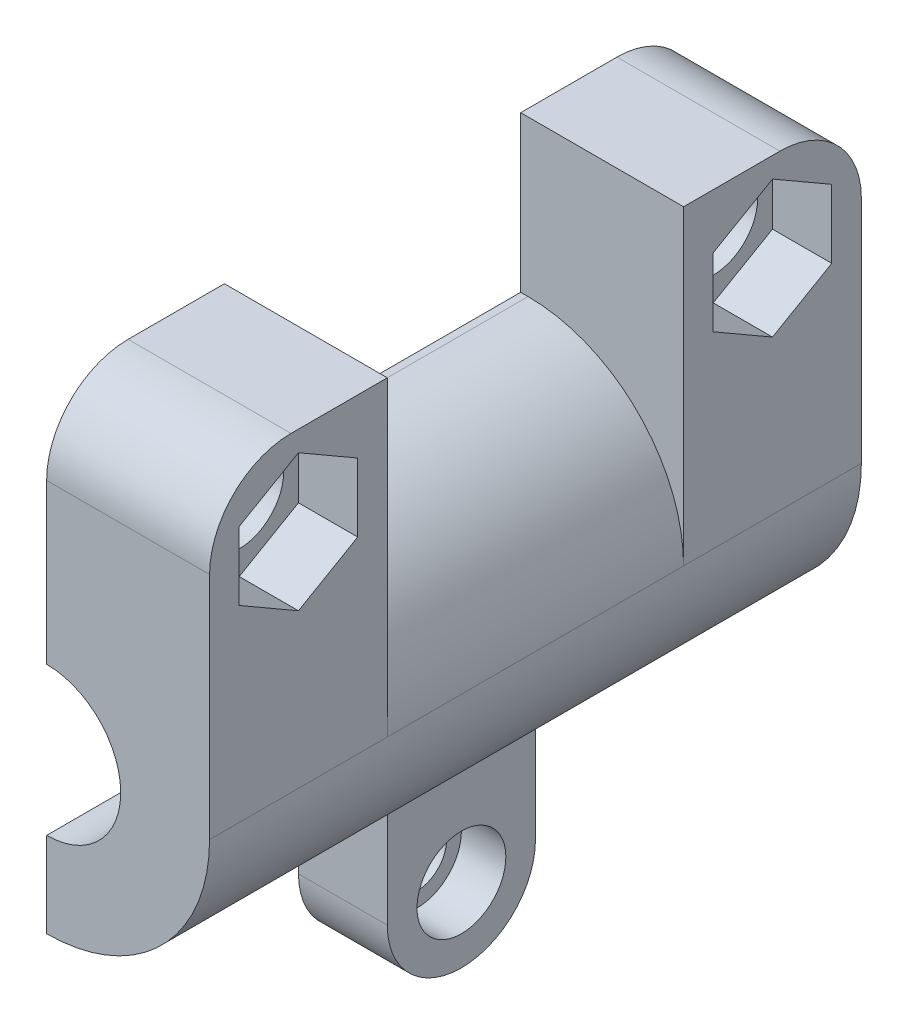
from build123d import *

# Parameters (mm, degrees)
SKETCH1_W               = 44
SKETCH1_H               = 32
BOSS_EXTRUDE1_DEPTH     = 11
SKETCH2_W               = 24.5
SKETCH2_H               = 15.5
CUT_EXTRUDE1_DEPTH      = 7.75
FILLET1_R               = 7.75
CUT_EXTRUDE2_DEPTH      = 40.370833113
CUT_EXTRUDE2_DEPTH_BACK = 40.370833113
SKETCH4_R               = 3
SKETCH4_W               = 20
SKETCH4_H               = 10.5
CUT_EXTRUDE3_DEPTH      = 30.342801502
FILLET4_R               = 5.5
SKETCH7_W               = 10
SKETCH7_H               = 10
SKETCH7_R               = 2
BOSS_EXTRUDE5_DEPTH     = 6
FILLET5_R               = 5
CUT_EXTRUDE7_START      = -3
SKETCH9_R               = 3
SKETCH9_R_2             = 2
CUT_EXTRUDE7_DEPTH      = 3
SKETCH10_R              = 3
CUT_EXTRUDE8_DEPTH      = 4
FILLET7_R               = 10.5
FILLET8_R               = 11


# Some blends are built 0.0001 mm under size
with BuildPart() as part:
    # Sketch1 → Boss-Extrude1 (new body)
    with BuildSketch(Plane(origin=(0, 0, 0), x_dir=(0, 0, -1), z_dir=(1, 0, 0))):
        Rectangle(SKETCH1_W, SKETCH1_H)
    extrude(amount=BOSS_EXTRUDE1_DEPTH)

    # Sketch2 → Cut-Extrude1 (cut)
    with BuildSketch(Plane(origin=(0, 0, 0), x_dir=(0, 0, -1), z_dir=(1, 0, 0))):
        with Locations((0, -5.25)):
            Rectangle(SKETCH2_W, SKETCH2_H)
    extrude(amount=CUT_EXTRUDE1_DEPTH, mode=Mode.SUBTRACT)

    # Fillet1
    fillet1_edges = [part.edges().sort_by_distance(p)[0] for p in [
        (7.75, 2.5, 0),
        (7.75, -13, 0),
    ]]
    fillet(fillet1_edges, radius=FILLET1_R - 0.0001)  # a hair under: the kernel refuses the full size

    # Sketch3 → Cut-Extrude2 (cut, two sides: drawn at the far end of the back side and taken through both)
    with BuildSketch(Plane.XY.offset(-12.25).offset(-CUT_EXTRUDE2_DEPTH_BACK)):
        with BuildLine():
            ThreePointArc((0, -10.25), (3.535533906, -8.785533906), (5, -5.25))
            ThreePointArc((5, -5.25), (3.535533906, -1.714466094), (0, -0.25))
            Line((0, -0.25), (0, -10.25))
        make_face()
        with BuildLine():
            Line((0, -10.25), (0, -0.25))
            ThreePointArc((0, -0.25), (-5, -5.25), (0, -10.25))
        make_face()
    extrude(amount=CUT_EXTRUDE2_DEPTH + CUT_EXTRUDE2_DEPTH_BACK, mode=Mode.SUBTRACT)

    # Sketch4 → Cut-Extrude3 (cut, through all)
    with BuildSketch(Plane(origin=(11, 0, 0), x_dir=(0, 0, -1), z_dir=(1, 0, 0))):
        with Locations((-16, 10)):
            Circle(SKETCH4_R)
        with Locations((16, 10)):
            Circle(SKETCH4_R)
        with Locations((0, 10.75)):
            Rectangle(SKETCH4_W, SKETCH4_H)
    extrude(amount=-CUT_EXTRUDE3_DEPTH, mode=Mode.SUBTRACT)

    # Fillet4
    fillet4_edges = [part.edges().sort_by_distance(p)[0] for p in [
        (5.5, 16, 22),
        (5.5, 16, -22),
    ]]
    fillet(fillet4_edges, radius=FILLET4_R)

    # Sketch7 → Boss-Extrude5 (add)
    with BuildSketch(Plane(origin=(0, 0, 0), x_dir=(0, 0, -1), z_dir=(1, 0, 0))):
        with Locations((0, -21)):
            Rectangle(SKETCH7_W, SKETCH7_H)
        with Locations((0, -21)):
            Circle(SKETCH7_R, mode=Mode.SUBTRACT)
    extrude(amount=BOSS_EXTRUDE5_DEPTH)

    # Fillet5
    fillet5_edges = [part.edges().sort_by_distance(p)[0] for p in [
        (3, -26, -5),
        (3, -26, 5),
    ]]
    fillet(fillet5_edges, radius=FILLET5_R - 0.0001)  # a hair under: the kernel refuses the full size

    # Sketch9 → Cut-Extrude7 (cut)
    with BuildSketch(Plane(origin=(6, 0, 0), x_dir=(0, 0, -1), z_dir=(1, 0, 0)).offset(CUT_EXTRUDE7_START)):
        with Locations((0, -21)):
            Circle(SKETCH9_R)
        with Locations((0, -21)):
            Circle(SKETCH9_R_2, mode=Mode.SUBTRACT)
    extrude(amount=CUT_EXTRUDE7_DEPTH, mode=Mode.SUBTRACT)

    # Sketch10 → Cut-Extrude8 (cut)
    # profile 1 of 2: a face of its own
    with BuildSketch(Plane(origin=(11, 0, 0), x_dir=(0, 0, -1), z_dir=(1, 0, 0))):
        Polygon((-16, 5.381197846), (-12, 7.690598923), (-12, 12.309401077), (-16, 14.618802154), (-20, 12.309401077), (-20, 7.690598923), align=None)
        with Locations((-16, 10)):
            Circle(SKETCH10_R, mode=Mode.SUBTRACT)
    # profile 2 of 2: a face of its own
    with BuildSketch(Plane(origin=(11, 0, 0), x_dir=(0, 0, -1), z_dir=(1, 0, 0))):
        Polygon((16, 5.381197846), (20, 7.690598923), (20, 12.309401077), (16, 14.618802154), (12, 12.309401077), (12, 7.690598923), align=None)
        with Locations((16, 10)):
            Circle(SKETCH10_R, mode=Mode.SUBTRACT)
    extrude(amount=-CUT_EXTRUDE8_DEPTH, mode=Mode.SUBTRACT)

    # Fillet7
    fillet7_edges = [part.edges().sort_by_distance(p)[0] for p in [
        (11, 5.5, 0),
    ]]
    fillet(fillet7_edges, radius=FILLET7_R)

    # Fillet8
    # the kernel refuses this fillet: 11 mm, written as the material it takes off along each edge
    with BuildSketch(Plane(origin=(11, -16, 49.5), x_dir=(0, 1, 0), z_dir=(0, 0, -1))) as fillet8_piece_1_section:
        with BuildLine():
            CenterArc((FILLET8_R, -FILLET8_R), FILLET8_R, 90, 90)
            Line((0, -FILLET8_R), (0, 0))
            Line((0, 0), (FILLET8_R, 0))
        make_face()
    fillet8_piece_1 = extrude(amount=99, mode=Mode.PRIVATE)
    fillet8_piece_1 = split(fillet8_piece_1, bisect_by=Plane(origin=(6, -13.119412113, 27.25), z_dir=(1, 0, 0)), keep=Keep.TOP, mode=Mode.PRIVATE)
    fillet8_piece_1 = split(fillet8_piece_1, bisect_by=Plane(origin=(9.313036117, -13.119412113, 5), z_dir=(0, 0, 1)), keep=Keep.TOP, mode=Mode.PRIVATE)
    add(fillet8_piece_1, mode=Mode.SUBTRACT)
    with BuildSketch(Plane(origin=(11, -16, 49.5), x_dir=(0, 1, 0), z_dir=(0, 0, -1))) as fillet8_piece_2_section:
        with BuildLine():
            CenterArc((FILLET8_R, -FILLET8_R), FILLET8_R, 90, 90)
            Line((0, -FILLET8_R), (0, 0))
            Line((0, 0), (FILLET8_R, 0))
        make_face()
    fillet8_piece_2 = extrude(amount=99, mode=Mode.PRIVATE)
    fillet8_piece_2 = split(fillet8_piece_2, bisect_by=Plane(origin=(6, -15.650616863, 27.25), z_dir=(-1, 0, 0)), keep=Keep.TOP, mode=Mode.PRIVATE)
    fillet8_piece_2 = split(fillet8_piece_2, bisect_by=Plane(origin=(4.102097244, -15.650616863, 5), z_dir=(0, 0, 1)), keep=Keep.TOP, mode=Mode.PRIVATE)
    add(fillet8_piece_2, mode=Mode.SUBTRACT)
    with BuildSketch(Plane(origin=(11, -16, 49.5), x_dir=(0, 1, 0), z_dir=(0, 0, -1))) as fillet8_piece_3_section:
        with BuildLine():
            CenterArc((FILLET8_R, -FILLET8_R), FILLET8_R, 90, 90)
            Line((0, -FILLET8_R), (0, 0))
            Line((0, 0), (FILLET8_R, 0))
        make_face()
    fillet8_piece_3 = extrude(amount=99, mode=Mode.PRIVATE)
    fillet8_piece_3 = split(fillet8_piece_3, bisect_by=Plane(origin=(6, -13.119412113, 0), z_dir=(1, 0, 0)), keep=Keep.TOP, mode=Mode.PRIVATE)
    fillet8_piece_3 = split(fillet8_piece_3, bisect_by=Plane(origin=(9.313036117, -13.119412113, -5), z_dir=(0, 0, 1)), keep=Keep.TOP, mode=Mode.PRIVATE)
    fillet8_piece_3 = split(fillet8_piece_3, bisect_by=Plane(origin=(9.313036117, -13.119412113, 5), z_dir=(0, 0, -1)), keep=Keep.TOP, mode=Mode.PRIVATE)
    add(fillet8_piece_3, mode=Mode.SUBTRACT)
    with BuildSketch(Plane(origin=(11, -16, 49.5), x_dir=(0, 1, 0), z_dir=(0, 0, -1))) as fillet8_piece_4_section:
        with BuildLine():
            CenterArc((FILLET8_R, -FILLET8_R), FILLET8_R, 90, 90)
            Line((0, -FILLET8_R), (0, 0))
            Line((0, 0), (FILLET8_R, 0))
        make_face()
    fillet8_piece_4 = extrude(amount=99, mode=Mode.PRIVATE)
    fillet8_piece_4 = split(fillet8_piece_4, bisect_by=Plane(origin=(6, -13.119412113, -27.25), z_dir=(1, 0, 0)), keep=Keep.TOP, mode=Mode.PRIVATE)
    fillet8_piece_4 = split(fillet8_piece_4, bisect_by=Plane(origin=(9.313036117, -13.119412113, -5), z_dir=(0, 0, -1)), keep=Keep.TOP, mode=Mode.PRIVATE)
    add(fillet8_piece_4, mode=Mode.SUBTRACT)
    with BuildSketch(Plane(origin=(11, -16, 49.5), x_dir=(0, 1, 0), z_dir=(0, 0, -1))) as fillet8_piece_5_section:
        with BuildLine():
            CenterArc((FILLET8_R, -FILLET8_R), FILLET8_R, 90, 90)
            Line((0, -FILLET8_R), (0, 0))
            Line((0, 0), (FILLET8_R, 0))
        make_face()
    fillet8_piece_5 = extrude(amount=99, mode=Mode.PRIVATE)
    fillet8_piece_5 = split(fillet8_piece_5, bisect_by=Plane(origin=(6, -15.650616863, -27.25), z_dir=(-1, 0, 0)), keep=Keep.TOP, mode=Mode.PRIVATE)
    fillet8_piece_5 = split(fillet8_piece_5, bisect_by=Plane(origin=(4.102097244, -15.650616863, -5), z_dir=(0, 0, -1)), keep=Keep.TOP, mode=Mode.PRIVATE)
    add(fillet8_piece_5, mode=Mode.SUBTRACT)


solid = part.part
